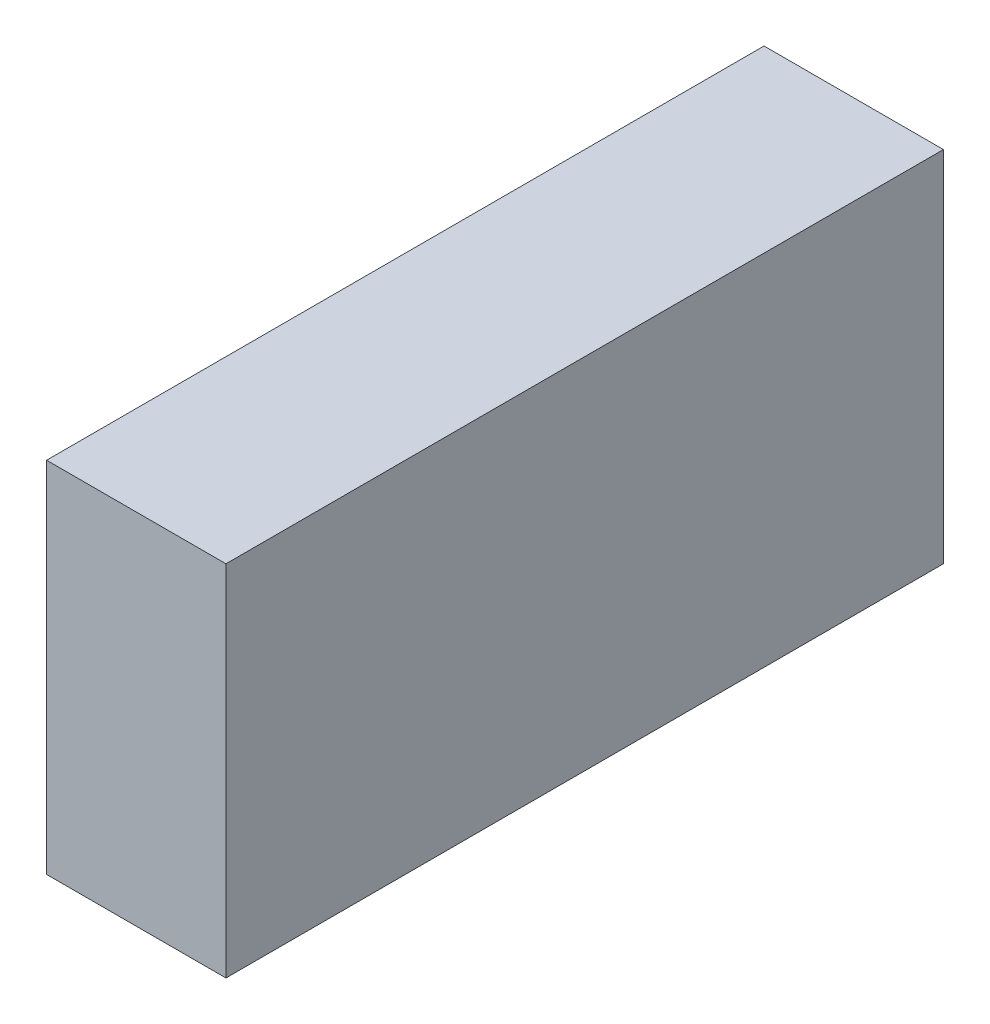
from build123d import *

# Parameters (mm, degrees)
SKETCH1_W           = 40
SKETCH1_H           = 20
BOSS_EXTRUDE1_DEPTH = 10


with BuildPart() as part:
    # Sketch1 → Boss-Extrude1 (new body)
    with BuildSketch(Plane(origin=(0, 0, 0), x_dir=(0, 0, -1), z_dir=(1, 0, 0))):
        with Locations((20, 10)):
            Rectangle(SKETCH1_W, SKETCH1_H)
    extrude(amount=BOSS_EXTRUDE1_DEPTH)


solid = part.part
